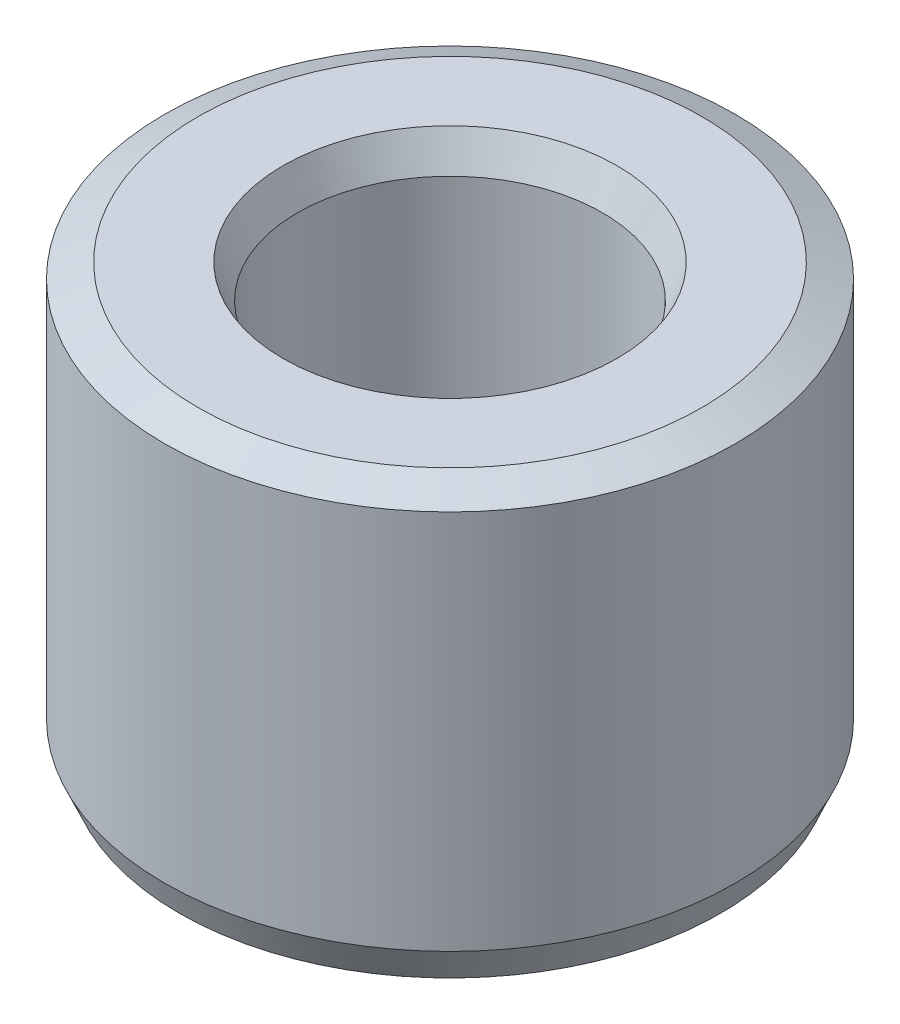
from build123d import *
from OCP.BRepFilletAPI import BRepFilletAPI_MakeChamfer

# Parameters (mm, degrees)
SKETCH1_R           = 60
BOSS_EXTRUDE1_DEPTH = 90.120224632
SKETCH2_R           = 32.038899883
CUT_EXTRUDE1_DEPTH  = 124.780672513
CHAMFER1_SIZE       = 3.077840318
CHAMFER1_SIZE2      = 7.015311709


with BuildPart() as part:
    # Sketch1 → Boss-Extrude1 (new body)
    with BuildSketch(Plane(origin=(0, 0, 0), x_dir=(1, 0, 0), z_dir=(0, 1, 0))):
        Circle(SKETCH1_R)
    extrude(amount=BOSS_EXTRUDE1_DEPTH)

    # Sketch2 → Cut-Extrude1 (cut, through all)
    with BuildSketch(Plane(origin=(0, 0, 0), x_dir=(1, 0, 0), z_dir=(0, 1, 0))):
        Circle(SKETCH2_R)
    extrude(amount=CUT_EXTRUDE1_DEPTH, mode=Mode.SUBTRACT)

    # Chamfer1: one chamfer whose edges measure the first distance from different faces: ONE call of the kernel's chamfer builder (chamfer() names one face for all edges)
    chamfer1_edges_1 = [part.edges().sort_by_distance(p)[0] for p in [
        (-32.038899883, 90.120224632, 0),
    ]]
    chamfer1_side_1 = [part.faces().sort_by_distance(p)[0] for p in [
        (-58.302943725, 90.120224632, 0),
    ]]
    chamfer1_edges_2 = [part.edges().sort_by_distance(p)[0] for p in [
        (-32.038899883, 0, 0),
    ]]
    chamfer1_side_2 = [part.faces().sort_by_distance(p)[0] for p in [
        (-32.038899883, 45.060112316, 0),
    ]]
    chamfer1_edges_3 = [part.edges().sort_by_distance(p)[0] for p in [
        (-60, 0, 0),
    ]]
    chamfer1_side_3 = [part.faces().sort_by_distance(p)[0] for p in [
        (-58.302943725, 0, 0),
    ]]
    chamfer1_edges_4 = [part.edges().sort_by_distance(p)[0] for p in [
        (-60, 90.120224632, 0),
    ]]
    chamfer1_side_4 = [part.faces().sort_by_distance(p)[0] for p in [
        (-60, 45.060112316, 0),
    ]]
    chamfer1 = BRepFilletAPI_MakeChamfer(part.part.solid().wrapped)
    for e in chamfer1_edges_1:
        chamfer1.Add(CHAMFER1_SIZE, CHAMFER1_SIZE2, e.wrapped, chamfer1_side_1[0].wrapped)  # the first distance lies on this face
    for e in chamfer1_edges_2:
        chamfer1.Add(CHAMFER1_SIZE, CHAMFER1_SIZE2, e.wrapped, chamfer1_side_2[0].wrapped)  # the first distance lies on this face
    for e in chamfer1_edges_3:
        chamfer1.Add(CHAMFER1_SIZE, CHAMFER1_SIZE2, e.wrapped, chamfer1_side_3[0].wrapped)  # the first distance lies on this face
    for e in chamfer1_edges_4:
        chamfer1.Add(CHAMFER1_SIZE, CHAMFER1_SIZE2, e.wrapped, chamfer1_side_4[0].wrapped)  # the first distance lies on this face
    add(Compound.cast(chamfer1.Shape()), mode=Mode.REPLACE)


solid = part.part
